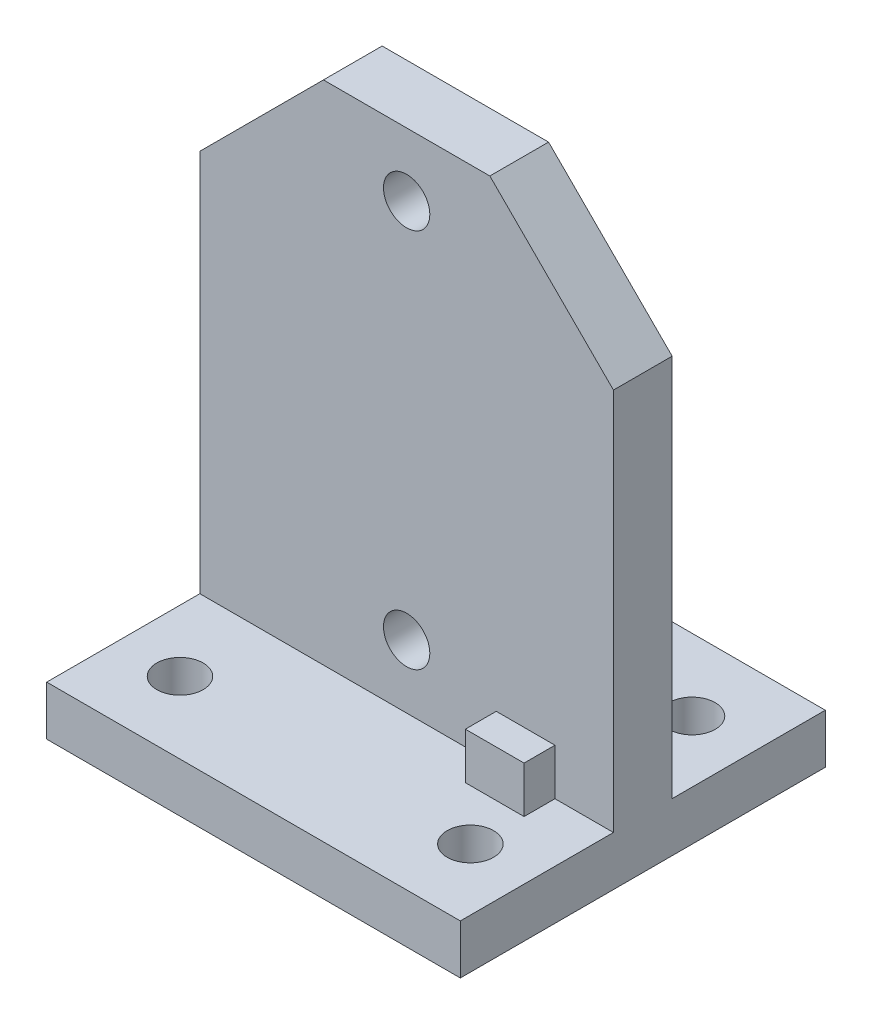
from build123d import *

# Parameters (mm, degrees)
SKETCH1_R           = 1.905
BOSS_EXTRUDE1_DEPTH = 2.413
SKETCH3_W           = 34
SKETCH3_H           = 30
SKETCH3_R           = 1.905
BOSS_EXTRUDE2_DEPTH = 4.064
SKETCH4_W           = 4.826
SKETCH4_H           = 3.81
BOSS_EXTRUDE3_DEPTH = 4.953


with BuildPart() as part:
    # Sketch1 → Boss-Extrude1 (new, symmetric)
    with BuildSketch(Plane.XY):
        Polygon((-17, 0), (17, 0), (17, 31.496), (6.84, 41.656), (-6.84, 41.656), (-17, 31.496), align=None)
        with Locations((0, 5.207)):
            Circle(SKETCH1_R, mode=Mode.SUBTRACT)
        with Locations((0, 36.449)):
            Circle(SKETCH1_R, mode=Mode.SUBTRACT)
    extrude(amount=BOSS_EXTRUDE1_DEPTH, both=True)

    # Sketch3 → Boss-Extrude2 (add)
    with BuildSketch(Plane(origin=(0, 0, 0), x_dir=(1, 0, 0), z_dir=(0, 1, 0))):
        Rectangle(SKETCH3_W, SKETCH3_H)
        with Locations((-11.935, -9.11)):
            Circle(SKETCH3_R, mode=Mode.SUBTRACT)
        with Locations((11.935, -9.11)):
            Circle(SKETCH3_R, mode=Mode.SUBTRACT)
        with Locations((11.935, 9.11)):
            Circle(SKETCH3_R, mode=Mode.SUBTRACT)
        with Locations((-11.935, 9.11)):
            Circle(SKETCH3_R, mode=Mode.SUBTRACT)
    extrude(amount=-BOSS_EXTRUDE2_DEPTH)

    # Sketch4 → Boss-Extrude3 (add, symmetric)
    with BuildSketch(Plane.XY):
        with Locations((9.779, 1.905)):
            Rectangle(SKETCH4_W, SKETCH4_H)
    extrude(amount=BOSS_EXTRUDE3_DEPTH, both=True)


solid = part.part
